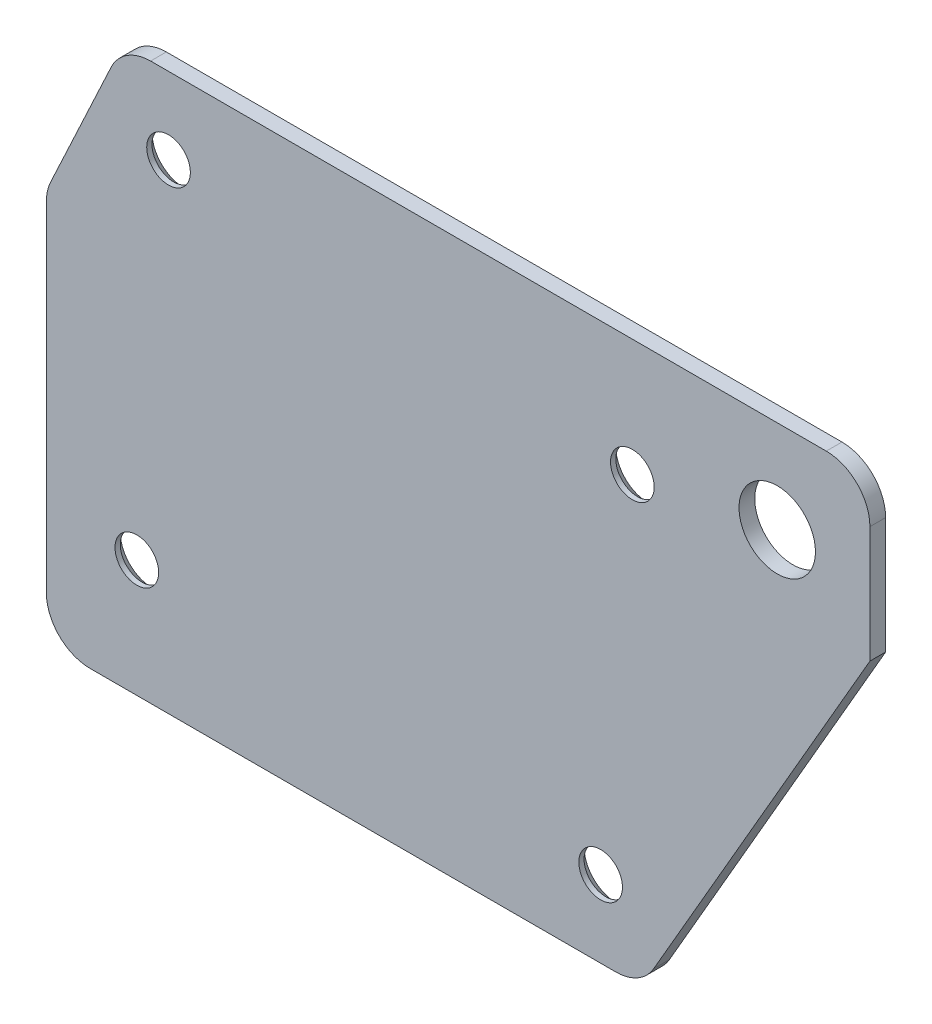
from build123d import *

# Parameters (mm, degrees)
SKETCH11_R                        = 5.5626
BASE_FLANGE1_DEPTH                = 2.286
CSK_FOR_M4_FH_MODIFIED_AT_2_COUNT = 2
CSK_FOR_M4_FH_MODIFIED_AT_2_PITCH = 67.76892481
CSK_FOR_M4_FH_MODIFIED_AT_3_COUNT = 2
CSK_FOR_M4_FH_MODIFIED_AT_3_PITCH = 86
CSK_FOR_M4_FH_MODIFIED_AT_4_COUNT = 2
CSK_FOR_M4_FH_MODIFIED_AT_4_PITCH = 52.946886878
CUT_EXTRUDE1_DEPTH                = 82.450069543
FILLET1_R                         = 6.35


# Sheet-metal steps are written as plain solids
with BuildPart() as part:
    # Sketch11 → Base-Flange1 (new body)
    with BuildSketch(Plane.XY):
        Polygon((-49.2252, 40.4876), (-49.2252, -40.4876), (37.337994573, -40.4876), (70.6374, 17.188662062), (70.6374, 40.4876), align=None)
        with Locations((57.15, 27.0002)):
            Circle(SKETCH11_R, mode=Mode.SUBTRACT)
    extrude(amount=-BASE_FLANGE1_DEPTH)

    # Sketch15 → CSK for M4 FH Modified (revolve, cut)
    with BuildSketch(Plane(origin=(36.062834422, 23.419478506, -2.286), x_dir=(0, 1, 0), z_dir=(1, 0, 0))):
        Polygon((0, 0), (0, 2.286), (3.175, 2.286), (3.175, 1.524), (4.699, 0), align=None)
    csk_for_m4_fh_modified = revolve(axis=Axis((36.062834422, 23.419478506, -8.636), (0, 0, 1)), mode=Mode.SUBTRACT)

    # CSK for M4 FH Modified at 2: CSK for M4 FH Modified ×2
    with Locations(*[Vector(-0.9961946980917455, 0.08715574274765803, 0) * (i * CSK_FOR_M4_FH_MODIFIED_AT_2_PITCH) for i in range(1, CSK_FOR_M4_FH_MODIFIED_AT_2_COUNT)]):
        add(csk_for_m4_fh_modified, mode=Mode.SUBTRACT)

    # CSK for M4 FH Modified at 3: CSK for M4 FH Modified ×2
    with Locations(*[Vector(-0.838670567945423, -0.5446390350150286, 0) * (i * CSK_FOR_M4_FH_MODIFIED_AT_3_PITCH) for i in range(1, CSK_FOR_M4_FH_MODIFIED_AT_3_COUNT)]):
        add(csk_for_m4_fh_modified, mode=Mode.SUBTRACT)

    # CSK for M4 FH Modified at 4: CSK for M4 FH Modified ×2
    with Locations(*[Vector(-0.08715574274765796, -0.9961946980917455, 0) * (i * CSK_FOR_M4_FH_MODIFIED_AT_4_PITCH) for i in range(1, CSK_FOR_M4_FH_MODIFIED_AT_4_COUNT)]):
        add(csk_for_m4_fh_modified, mode=Mode.SUBTRACT)

    # Sketch17 → Cut-Extrude1 (cut, through all)
    with BuildSketch(Plane.XY):
        Polygon((-34.546735645, 48.1076), (-56.8452, 0.288388874), (-56.8452, 48.1076), align=None)
    extrude(amount=-CUT_EXTRUDE1_DEPTH, mode=Mode.SUBTRACT)

    # Fillet1
    fillet1_edges = [part.edges().sort_by_distance(p)[0] for p in [
        (-49.2252, 16.629531608, -1.143),
        (-38.1, 40.4876, -1.143),
        (37.337994573, -40.4876, -1.143),
        (-49.2252, -40.4876, -1.143),
        (70.6374, 40.4876, -1.143),
    ]]
    fillet(fillet1_edges, radius=FILLET1_R)


solid = part.part
